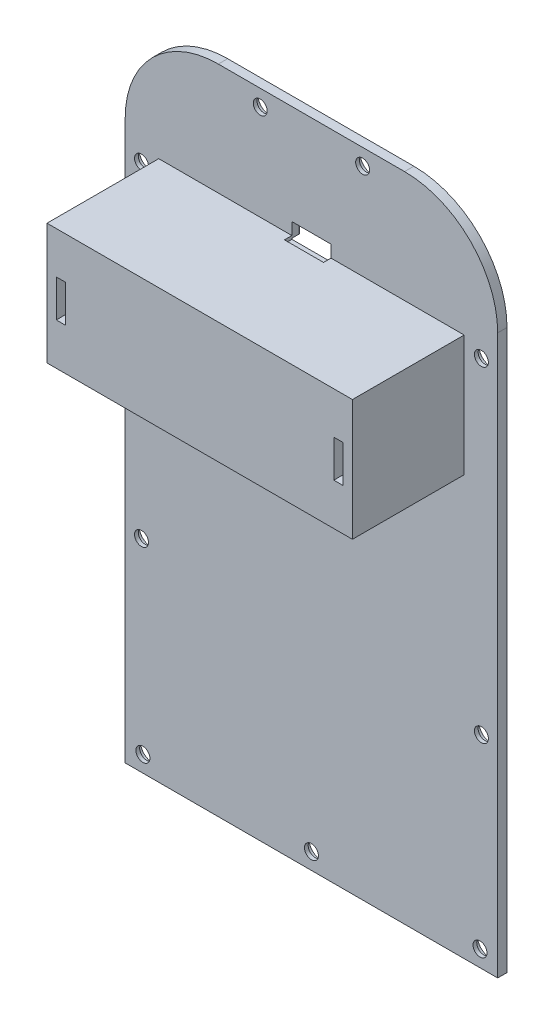
from build123d import *

# Parameters (mm, degrees)
CROQUIS1_W              = 40
CROQUIS1_H              = 70
SALIENTE_EXTRUIR1_DEPTH = 1
REDONDEO1_R             = 10
CORTAR_EXTRUIR1_REACH   = 50.527
CROQUIS2_R              = 0.75
CROQUIS5_W              = 32.8
CROQUIS5_H              = 13
SALIENTE_EXTRUIR2_DEPTH = 12
VACIADO1_START          = -15.316182085
VACIADO1_OUTLINE_W      = 11
VACIADO1_OUTLINE_H      = 12
VACIADO1_DEPTH          = 30.8
CORTAR_EXTRUIR4_REACH   = 51.979
CROQUIS6_W              = 1
CROQUIS6_H              = 4
CROQUIS7_W              = 32.3
CROQUIS7_H              = 12.5
CORTAR_EXTRUIR5_DEPTH   = 1
CROQUIS8_W              = 4.2
CROQUIS8_H              = 4
CORTAR_EXTRUIR6_DEPTH   = 0.6
REDONDEO2_R             = 1
REDONDEO3_R             = 0.3
CROQUIS9_W              = 4.2
CROQUIS9_H              = 1.65
CORTAR_EXTRUIR7_DEPTH   = 1.2
CROQUIS10_W             = 2
CROQUIS10_H             = 0.5
CORTAR_EXTRUIR8_DEPTH   = 1.5
CROQUIS11_R             = 1.25
CORTAR_EXTRUIR9_DEPTH   = 0.6
SALIENTE_EXTRUIR3_REACH = 51.979
CROQUIS12_W             = 0.5
CROQUIS12_H             = 2


# Read off the part's stored shape, not the designer's step: Vaciado1
with BuildPart() as part:
    # Croquis1 → Saliente-Extruir1 (new body)
    with BuildSketch(Plane.XY):
        with Locations((0.083817915, -9.164456233)):
            Rectangle(CROQUIS1_W, CROQUIS1_H)
    extrude(amount=SALIENTE_EXTRUIR1_DEPTH)

    # Redondeo1
    redondeo1_edges = [part.edges().sort_by_distance(p)[0] for p in [
        (-19.916182085, 25.835543767, 0.5),
        (20.083817915, 25.835543767, 0.5),
    ]]
    fillet(redondeo1_edges, radius=REDONDEO1_R)

    # Croquis2 → Cortar-Extruir1 (cut, up to next)
    with BuildSketch(Plane(origin=(0, 0, 0), x_dir=(-1, 0, 0), z_dir=(0, 0, -1)), mode=Mode.PRIVATE) as cortar_extruir1_sk1:
        with Locations((-5.583817915, 24.085543767)):
            Circle(CROQUIS2_R)
    cortar_extruir1_tool1 = extrude(cortar_extruir1_sk1.sketch, amount=-CORTAR_EXTRUIR1_REACH, mode=Mode.PRIVATE) & part.part
    # Croquis2 → Cortar-Extruir1 (cut, up to next)
    with BuildSketch(Plane(origin=(0, 0, 0), x_dir=(-1, 0, 0), z_dir=(0, 0, -1)), mode=Mode.PRIVATE) as cortar_extruir1_sk2:
        with Locations((5.416182085, 24.085543767)):
            Circle(CROQUIS2_R)
    cortar_extruir1_tool2 = extrude(cortar_extruir1_sk2.sketch, amount=-CORTAR_EXTRUIR1_REACH, mode=Mode.PRIVATE) & part.part
    # Croquis2 → Cortar-Extruir1 (cut, up to next)
    with BuildSketch(Plane(origin=(0, 0, 0), x_dir=(-1, 0, 0), z_dir=(0, 0, -1)), mode=Mode.PRIVATE) as cortar_extruir1_sk3:
        with Locations((-18.183817915, -42.414456233)):
            Circle(CROQUIS2_R)
    cortar_extruir1_tool3 = extrude(cortar_extruir1_sk3.sketch, amount=-CORTAR_EXTRUIR1_REACH, mode=Mode.PRIVATE) & part.part
    # Croquis2 → Cortar-Extruir1 (cut, up to next)
    with BuildSketch(Plane(origin=(0, 0, 0), x_dir=(-1, 0, 0), z_dir=(0, 0, -1)), mode=Mode.PRIVATE) as cortar_extruir1_sk4:
        with Locations((-0.083817915, -42.414456233)):
            Circle(CROQUIS2_R)
    cortar_extruir1_tool4 = extrude(cortar_extruir1_sk4.sketch, amount=-CORTAR_EXTRUIR1_REACH, mode=Mode.PRIVATE) & part.part
    # Croquis2 → Cortar-Extruir1 (cut, up to next)
    with BuildSketch(Plane(origin=(0, 0, 0), x_dir=(-1, 0, 0), z_dir=(0, 0, -1)), mode=Mode.PRIVATE) as cortar_extruir1_sk5:
        with Locations((18.016182085, -42.414456233)):
            Circle(CROQUIS2_R)
    cortar_extruir1_tool5 = extrude(cortar_extruir1_sk5.sketch, amount=-CORTAR_EXTRUIR1_REACH, mode=Mode.PRIVATE) & part.part
    # Croquis2 → Cortar-Extruir1 (cut, up to next)
    with BuildSketch(Plane(origin=(0, 0, 0), x_dir=(-1, 0, 0), z_dir=(0, 0, -1)), mode=Mode.PRIVATE) as cortar_extruir1_sk6:
        with Locations((-18.333817915, 12.585543767)):
            Circle(CROQUIS2_R)
    cortar_extruir1_tool6 = extrude(cortar_extruir1_sk6.sketch, amount=-CORTAR_EXTRUIR1_REACH, mode=Mode.PRIVATE) & part.part
    # Croquis2 → Cortar-Extruir1 (cut, up to next)
    with BuildSketch(Plane(origin=(0, 0, 0), x_dir=(-1, 0, 0), z_dir=(0, 0, -1)), mode=Mode.PRIVATE) as cortar_extruir1_sk7:
        with Locations((-18.333817915, -22.414456233)):
            Circle(CROQUIS2_R)
    cortar_extruir1_tool7 = extrude(cortar_extruir1_sk7.sketch, amount=-CORTAR_EXTRUIR1_REACH, mode=Mode.PRIVATE) & part.part
    # Croquis2 → Cortar-Extruir1 (cut, up to next)
    with BuildSketch(Plane(origin=(0, 0, 0), x_dir=(-1, 0, 0), z_dir=(0, 0, -1)), mode=Mode.PRIVATE) as cortar_extruir1_sk8:
        with Locations((18.166182085, 12.585543767)):
            Circle(CROQUIS2_R)
    cortar_extruir1_tool8 = extrude(cortar_extruir1_sk8.sketch, amount=-CORTAR_EXTRUIR1_REACH, mode=Mode.PRIVATE) & part.part
    # Croquis2 → Cortar-Extruir1 (cut, up to next)
    with BuildSketch(Plane(origin=(0, 0, 0), x_dir=(-1, 0, 0), z_dir=(0, 0, -1)), mode=Mode.PRIVATE) as cortar_extruir1_sk9:
        with Locations((18.166182085, -22.414456233)):
            Circle(CROQUIS2_R)
    cortar_extruir1_tool9 = extrude(cortar_extruir1_sk9.sketch, amount=-CORTAR_EXTRUIR1_REACH, mode=Mode.PRIVATE) & part.part
    add(cortar_extruir1_tool1.solids().sort_by_distance((5.583818, 24.085544, 0))[0], mode=Mode.SUBTRACT)
    add(cortar_extruir1_tool2.solids().sort_by_distance((-5.416182, 24.085544, 0))[0], mode=Mode.SUBTRACT)
    add(cortar_extruir1_tool3.solids().sort_by_distance((18.183818, -42.414456, 0))[0], mode=Mode.SUBTRACT)
    add(cortar_extruir1_tool4.solids().sort_by_distance((0.083818, -42.414456, 0))[0], mode=Mode.SUBTRACT)
    add(cortar_extruir1_tool5.solids().sort_by_distance((-18.016182, -42.414456, 0))[0], mode=Mode.SUBTRACT)
    add(cortar_extruir1_tool6.solids().sort_by_distance((18.333818, 12.585544, 0))[0], mode=Mode.SUBTRACT)
    add(cortar_extruir1_tool7.solids().sort_by_distance((18.333818, -22.414456, 0))[0], mode=Mode.SUBTRACT)
    add(cortar_extruir1_tool8.solids().sort_by_distance((-18.166182, 12.585544, 0))[0], mode=Mode.SUBTRACT)
    add(cortar_extruir1_tool9.solids().sort_by_distance((-18.166182, -22.414456, 0))[0], mode=Mode.SUBTRACT)

    # Croquis5 → Saliente-Extruir2 (add)
    with BuildSketch(Plane.XY.offset(1)):
        with Locations((0.083817915, 7.335543767)):
            Rectangle(CROQUIS5_W, CROQUIS5_H)
    extrude(amount=SALIENTE_EXTRUIR2_DEPTH)

    # Vaciado1 outline → Vaciado1 (cut)
    with BuildSketch(Plane.YZ.offset(VACIADO1_START)):
        with Locations((7.335543767, 6)):
            Rectangle(VACIADO1_OUTLINE_W, VACIADO1_OUTLINE_H)
    extrude(amount=VACIADO1_DEPTH, mode=Mode.SUBTRACT)

    # Croquis6 → Cortar-Extruir4 (cut, up to next)
    with BuildSketch(Plane(origin=(0, 0, 12), x_dir=(-1, 0, 0), z_dir=(0, 0, -1)), mode=Mode.PRIVATE) as cortar_extruir4_sk1:
        with Locations((-14.983817915, 7.335543767)):
            Rectangle(CROQUIS6_W, CROQUIS6_H)
    cortar_extruir4_tool1 = extrude(cortar_extruir4_sk1.sketch, amount=-CORTAR_EXTRUIR4_REACH, mode=Mode.PRIVATE) & part.part
    # Croquis6 → Cortar-Extruir4 (cut, up to next)
    with BuildSketch(Plane(origin=(0, 0, 12), x_dir=(-1, 0, 0), z_dir=(0, 0, -1)), mode=Mode.PRIVATE) as cortar_extruir4_sk2:
        with Locations((14.816182085, 7.335543767)):
            Rectangle(CROQUIS6_W, CROQUIS6_H)
    cortar_extruir4_tool2 = extrude(cortar_extruir4_sk2.sketch, amount=-CORTAR_EXTRUIR4_REACH, mode=Mode.PRIVATE) & part.part
    add(cortar_extruir4_tool1.solids().sort_by_distance((14.983818, 7.335544, 12))[0], mode=Mode.SUBTRACT)
    add(cortar_extruir4_tool2.solids().sort_by_distance((-14.816182, 7.335544, 12))[0], mode=Mode.SUBTRACT)

    # Croquis7 → Cortar-Extruir5 (cut)
    with BuildSketch(Plane(origin=(0, 0, 0), x_dir=(-1, 0, 0), z_dir=(0, 0, -1))):
        with Locations((-0.083817915, 7.335543767)):
            Rectangle(CROQUIS7_W, CROQUIS7_H)
    extrude(amount=-CORTAR_EXTRUIR5_DEPTH, mode=Mode.SUBTRACT)

    # Croquis8 → Cortar-Extruir6 (cut)
    with BuildSketch(Plane(origin=(0, 0, 0), x_dir=(-1, 0, 0), z_dir=(0, 0, -1))):
        with Locations((-0.083817915, 15.585543767)):
            Rectangle(CROQUIS8_W, CROQUIS8_H)
    extrude(amount=-CORTAR_EXTRUIR6_DEPTH, mode=Mode.SUBTRACT)

    # Redondeo2
    redondeo2_edges = [part.edges().sort_by_distance(p)[0] for p in [
        (2.183817915, 17.585543767, 0.3),
        (-2.016182085, 17.585543767, 0.3),
    ]]
    fillet(redondeo2_edges, radius=REDONDEO2_R)

    # Redondeo3
    redondeo3_edges = [part.edges().sort_by_distance(p)[0] for p in [
        (-2.016182085, 15.085543767, 0),
        (0.083817915, 17.585543767, 0),
        (2.183817915, 15.085543767, 0),
        (-1.723288867, 17.292650548, 0),
        (1.890924696, 17.292650548, 0),
    ]]
    fillet(redondeo3_edges, radius=REDONDEO3_R)

    # Croquis9 → Cortar-Extruir7 (cut)
    with BuildSketch(Plane(origin=(0, 0, 0.6), x_dir=(-1, 0, 0), z_dir=(0, 0, -1))):
        with Locations((-0.083817915, 14.310543767)):
            Rectangle(CROQUIS9_W, CROQUIS9_H)
    extrude(amount=-CORTAR_EXTRUIR7_DEPTH, mode=Mode.SUBTRACT)

    # Croquis10 → Cortar-Extruir8 (cut)
    with BuildSketch(Plane(origin=(0, 1.085543767, 0), x_dir=(1, 0, 0), z_dir=(0, 1, 0))):
        with Locations((-13.066182085, -0.75)):
            Rectangle(CROQUIS10_W, CROQUIS10_H)
        with Locations((13.233817915, -0.75)):
            Rectangle(CROQUIS10_W, CROQUIS10_H)
    extrude(amount=-CORTAR_EXTRUIR8_DEPTH, mode=Mode.SUBTRACT)

    # Croquis11 → Cortar-Extruir9 (cut)
    with BuildSketch(Plane(origin=(0, 0, 0), x_dir=(-1, 0, 0), z_dir=(0, 0, -1))):
        with Locations((-5.583817915, 24.085543767)):
            Circle(CROQUIS11_R)
        with Locations((5.416182085, 24.085543767)):
            Circle(CROQUIS11_R)
        with Locations((18.166182085, 12.585543767)):
            Circle(CROQUIS11_R)
        with Locations((-18.333817915, 12.585543767)):
            Circle(CROQUIS11_R)
        with Locations((-18.333817915, -22.414456233)):
            Circle(CROQUIS11_R)
        with Locations((18.166182085, -22.414456233)):
            Circle(CROQUIS11_R)
        with Locations((18.016182085, -42.414456233)):
            Circle(CROQUIS11_R)
        with Locations((-0.083817915, -42.414456233)):
            Circle(CROQUIS11_R)
        with Locations((-18.183817915, -42.414456233)):
            Circle(CROQUIS11_R)
    extrude(amount=-CORTAR_EXTRUIR9_DEPTH, mode=Mode.SUBTRACT)

    # Croquis12 → Saliente-Extruir3 (add, up to next)
    with BuildSketch(Plane(origin=(0, 0, 1), x_dir=(-1, 0, 0), z_dir=(0, 0, -1)), mode=Mode.PRIVATE) as saliente_extruir3_sk1:
        with Locations((-14.733817915, 11.835543767)):
            Rectangle(CROQUIS12_W, CROQUIS12_H)
    saliente_extruir3_tool1 = extrude(saliente_extruir3_sk1.sketch, amount=-SALIENTE_EXTRUIR3_REACH, mode=Mode.PRIVATE) - part.part
    # Croquis12 → Saliente-Extruir3 (add, up to next)
    with BuildSketch(Plane(origin=(0, 0, 1), x_dir=(-1, 0, 0), z_dir=(0, 0, -1)), mode=Mode.PRIVATE) as saliente_extruir3_sk2:
        with Locations((-14.733817915, 2.835543767)):
            Rectangle(CROQUIS12_W, CROQUIS12_H)
    saliente_extruir3_tool2 = extrude(saliente_extruir3_sk2.sketch, amount=-SALIENTE_EXTRUIR3_REACH, mode=Mode.PRIVATE) - part.part
    # Croquis12 → Saliente-Extruir3 (add, up to next)
    with BuildSketch(Plane(origin=(0, 0, 1), x_dir=(-1, 0, 0), z_dir=(0, 0, -1)), mode=Mode.PRIVATE) as saliente_extruir3_sk3:
        with Locations((14.566182085, 11.835543767)):
            Rectangle(CROQUIS12_W, CROQUIS12_H)
    saliente_extruir3_tool3 = extrude(saliente_extruir3_sk3.sketch, amount=-SALIENTE_EXTRUIR3_REACH, mode=Mode.PRIVATE) - part.part
    # Croquis12 → Saliente-Extruir3 (add, up to next)
    with BuildSketch(Plane(origin=(0, 0, 1), x_dir=(-1, 0, 0), z_dir=(0, 0, -1)), mode=Mode.PRIVATE) as saliente_extruir3_sk4:
        with Locations((14.566182085, 2.835543767)):
            Rectangle(CROQUIS12_W, CROQUIS12_H)
    saliente_extruir3_tool4 = extrude(saliente_extruir3_sk4.sketch, amount=-SALIENTE_EXTRUIR3_REACH, mode=Mode.PRIVATE) - part.part
    add(saliente_extruir3_tool1.solids().sort_by_distance((14.733818, 11.835544, 1))[0])
    add(saliente_extruir3_tool2.solids().sort_by_distance((14.733818, 2.835544, 1))[0])
    add(saliente_extruir3_tool3.solids().sort_by_distance((-14.566182, 11.835544, 1))[0])
    add(saliente_extruir3_tool4.solids().sort_by_distance((-14.566182, 2.835544, 1))[0])


solid = part.part
